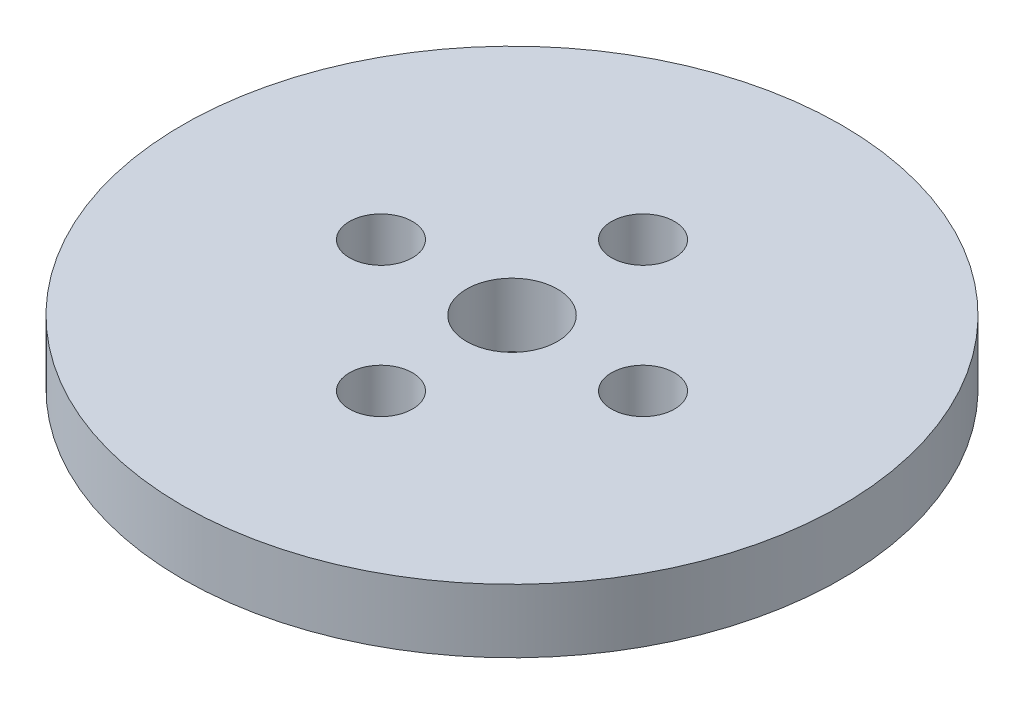
from build123d import *

# Parameters (mm, degrees)
SKETCH1_R           = 72.5
BOSS_EXTRUDE1_DEPTH = 14
SKETCH2_R           = 10
CUT_EXTRUDE1_DEPTH  = 104.481882472
SKETCH3_R           = 6.931557338
CUT_EXTRUDE2_DEPTH  = 12.17203466
CIRPATTERN1_COUNT   = 4


with BuildPart() as part:
    # Sketch1 → Boss-Extrude1 (new body)
    with BuildSketch(Plane(origin=(0, 0, 0), x_dir=(1, 0, 0), z_dir=(0, 1, 0))):
        Circle(SKETCH1_R)
    extrude(amount=BOSS_EXTRUDE1_DEPTH)

    # Sketch2 → Cut-Extrude1 (cut, through all)
    with BuildSketch(Plane(origin=(0, 0, 0), x_dir=(1, 0, 0), z_dir=(0, 1, 0))):
        Circle(SKETCH2_R)
    extrude(amount=CUT_EXTRUDE1_DEPTH, mode=Mode.SUBTRACT)

    # Sketch3 → Cut-Extrude2 (cut)
    with BuildSketch(Plane(origin=(0, 14, 0), x_dir=(1, 0, 0), z_dir=(0, 1, 0))):
        with Locations((-28.825294049, 0)):
            Circle(SKETCH3_R)
    cut_extrude2 = extrude(amount=-CUT_EXTRUDE2_DEPTH, mode=Mode.SUBTRACT)

    # CirPattern1: Cut-Extrude2 ×4 about axis
    cirpattern1_axis = Axis((0, 0, 0), (0, 1, 0))
    for i in range(1, CIRPATTERN1_COUNT):
        add(cut_extrude2.rotate(cirpattern1_axis, i * 360 / CIRPATTERN1_COUNT), mode=Mode.SUBTRACT)


solid = part.part
